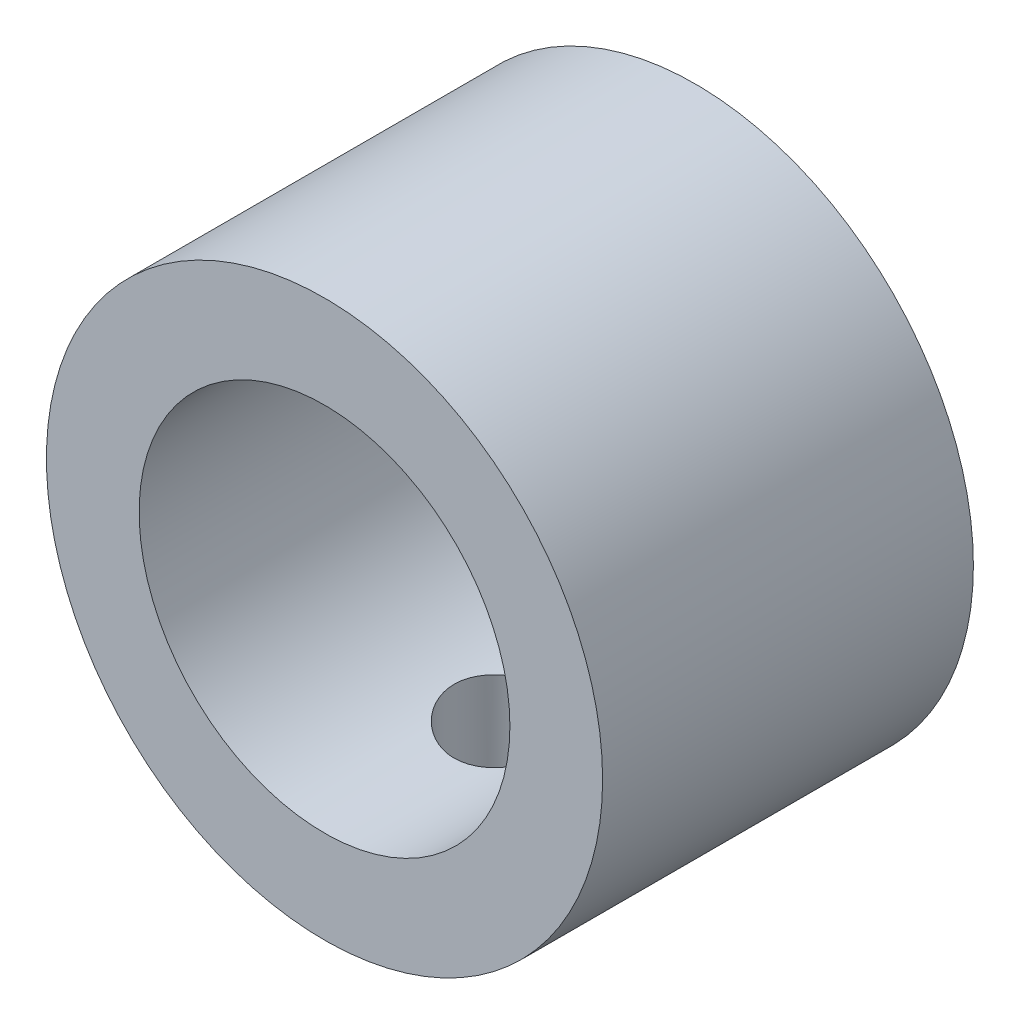
from build123d import *

# Parameters (mm, degrees)
SKETCH1_R           = 7.5
SKETCH1_R_2         = 5
BOSS_EXTRUDE1_DEPTH = 5
SKETCH3_R           = 1.5
CUT_EXTRUDE1_DEPTH  = 12.7260394


with BuildPart() as part:
    # Sketch1 → Boss-Extrude1 (new, symmetric)
    with BuildSketch(Plane.XY):
        Circle(SKETCH1_R)
        Circle(SKETCH1_R_2, mode=Mode.SUBTRACT)
    extrude(amount=BOSS_EXTRUDE1_DEPTH, both=True)

    # Sketch3 → Cut-Extrude1 (cut, through all)
    with BuildSketch(Plane(origin=(0, 0, 0), x_dir=(1, 0, 0), z_dir=(0, 1, 0))):
        Circle(SKETCH3_R)
    extrude(amount=-CUT_EXTRUDE1_DEPTH, mode=Mode.SUBTRACT)


solid = part.part
